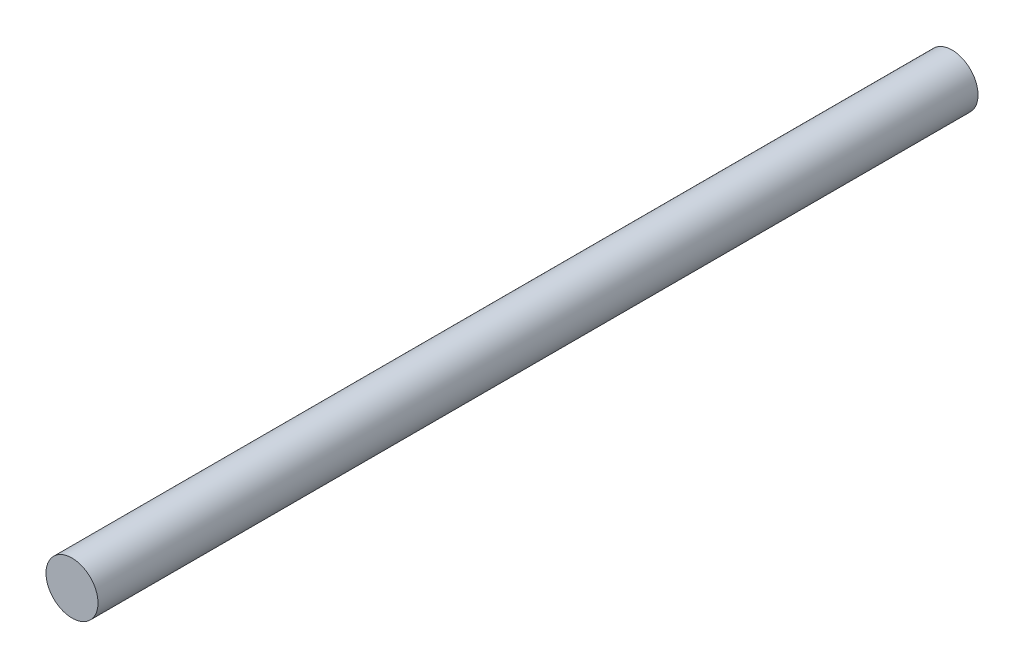
from build123d import *

# Parameters (mm, degrees)
SKETCH1_R           = 6
BOSS_EXTRUDE1_DEPTH = 101.5


with BuildPart() as part:
    # Sketch1 → Boss-Extrude1 (new, symmetric)
    with BuildSketch(Plane.XY):
        Circle(SKETCH1_R)
    extrude(amount=BOSS_EXTRUDE1_DEPTH, both=True)


solid = part.part
